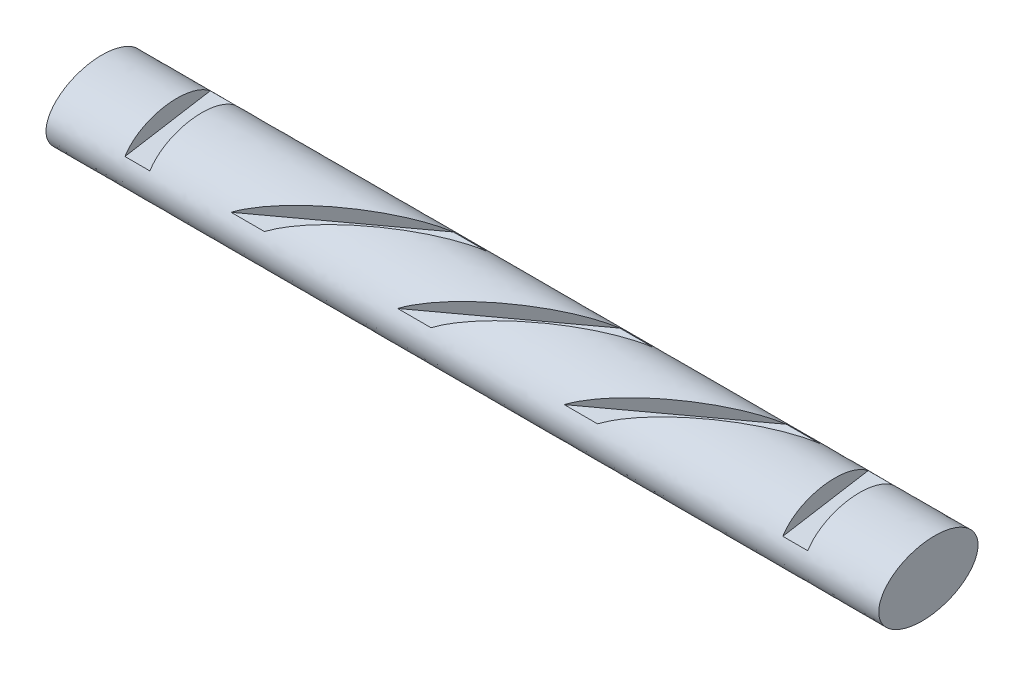
from build123d import *

# Parameters (mm, degrees)
SKETCH_2_RX            = 3
SKETCH_2_RY            = 2
EXTRUDE_1_DEPTH        = 50
SKETCH_5_W             = 1.5
SKETCH_5_H             = 1
CUT_EXTRUDE_2_DEPTH    = 25
CUT_EXTRUDE_4_DEPTH    = 25
PATTERN_START          = 97.264960027
PATTERN_LINEAR_1_DEPTH = 0.850363271
PATTERN_LINEAR_2_DEPTH = 0.850363271


# Read off the part's stored shape, not the designer's step: 阵列(线性)1, 阵列(线性)2
with BuildPart() as part:
    # 草图2 → 凸台-拉伸1 (new body)
    with BuildSketch(Plane(origin=(0, 0, 0), x_dir=(0, 0, -1), z_dir=(1, 0, 0))):
        with Locations(Location((-5.2411758, 96.567762113), (0, 0, 8.868937921))):
            Ellipse(SKETCH_2_RX, SKETCH_2_RY)
    extrude(amount=EXTRUDE_1_DEPTH)

    # 草图5 → 切除-拉伸2 (cut, symmetric)
    with BuildSketch(Plane(origin=(0, 1.757367098, -10.542320534), x_dir=(1, 0, 0), z_dir=(0, -0.1644275429715825, 0.986389164129619))):
        with Locations((5.25, 97.615322624)):
            Rectangle(SKETCH_5_W, SKETCH_5_H)
    cut_extrude_2 = extrude(amount=CUT_EXTRUDE_2_DEPTH, both=True, mode=Mode.SUBTRACT)

    # 镜向2: 切除-拉伸2 across plane
    add(cut_extrude_2.mirror(Plane(origin=(25, 0, 0), x_dir=(0, 0, 1), z_dir=(1, 0, 0))), mode=Mode.SUBTRACT)

    # 草图7 → 切除-拉伸4 (cut, symmetric)
    with BuildSketch(Plane(origin=(23.377948952, 2.219322141, -13.31355606), x_dir=(0.49999999999999795, -0.14239842929524804, 0.8542380741539494), z_dir=(-0.8660254037844399, -0.0822137714857909, 0.4931945820648075))):
        Polygon((3.244102096, 98.345137773), (4.244102028, 98.34550487), (4.244102028, 97.264960027), (3.244102096, 97.264960027), align=None)
    extrude(amount=CUT_EXTRUDE_4_DEPTH, both=True, mode=Mode.SUBTRACT)

    # 阵列(线性)1 outline → 阵列(线性)1 (cut)
    with BuildSketch(Plane(origin=(0, 0, 0), x_dir=(1, 0, 0), z_dir=(0, 0.986389164129618, 0.164427542971589)).offset(PATTERN_START)):
        Polygon((32.758607465, 8.239021249), (41.261648564, 13.148254316), (43, 14.151891985), (43, 15), (42.468966305, 15), (39.261648698, 13.148254316), (30.7586076, 8.239021249), (29, 7.223688678), (29, 7), (30.61255971, 7), align=None)
    extrude(amount=PATTERN_LINEAR_1_DEPTH, mode=Mode.SUBTRACT)

    # 阵列(线性)2 outline → 阵列(线性)2 (cut)
    with BuildSketch(Plane(origin=(0, 0, 0), x_dir=(1, 0, 0), z_dir=(0, 0.986389164129618, 0.164427542971589)).offset(PATTERN_START)):
        Polygon((12.758607465, 8.239021249), (21.261648564, 13.148254316), (23, 14.151891985), (23, 15), (22.468966305, 15), (19.261648698, 13.148254316), (10.7586076, 8.239021249), (9, 7.223688678), (9, 7), (10.61255971, 7), align=None)
    extrude(amount=PATTERN_LINEAR_2_DEPTH, mode=Mode.SUBTRACT)


solid = part.part
